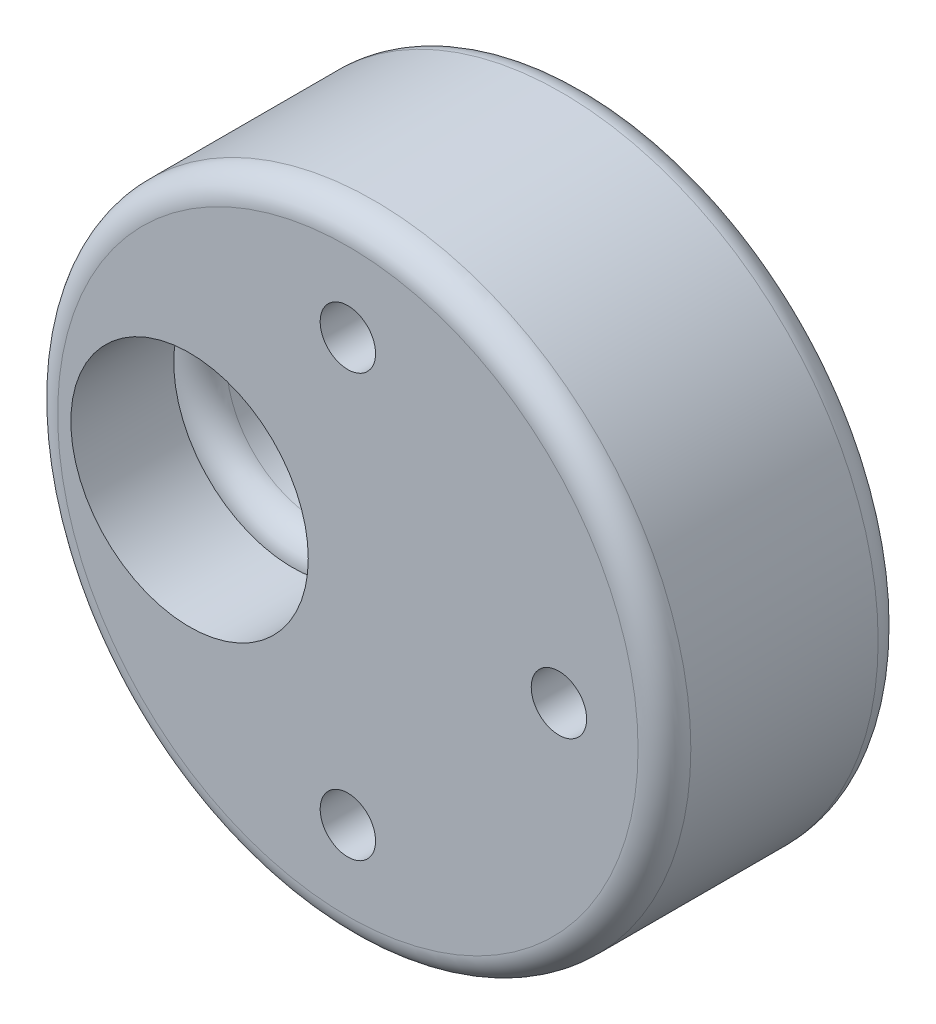
from build123d import *

# Parameters (mm, degrees)
SKETCH1_R           = 12
SKETCH1_R_2         = 1.05
BOSS_EXTRUDE1_DEPTH = 9.1
HOLE2_D             = 7
HOLE2_DEPTH         = 12
HOLE2_CBORE_D       = 9
HOLE2_CBORE_DEPTH   = 3.9
SKETCH8_R           = 2.15
CUT_EXTRUDE1_DEPTH  = 6.2
FILLET1_R           = 1


with BuildPart() as part:
    # Sketch1 → Boss-Extrude1 (new body)
    with BuildSketch(Plane.XY):
        Circle(SKETCH1_R)
        with Locations((0, 8)):
            Circle(SKETCH1_R_2, mode=Mode.SUBTRACT)
        with Locations((8, 0)):
            Circle(SKETCH1_R_2, mode=Mode.SUBTRACT)
        with Locations((0, -8)):
            Circle(SKETCH1_R_2, mode=Mode.SUBTRACT)
    extrude(amount=BOSS_EXTRUDE1_DEPTH)

    # Hole2
    with Locations(Plane.XY.offset(9.1)):
        with Locations((-6, 0)):
            CounterBoreHole(HOLE2_D / 2, HOLE2_CBORE_D / 2, HOLE2_CBORE_DEPTH, depth=HOLE2_DEPTH)

    # Sketch8 → Cut-Extrude1 (cut)
    with BuildSketch(Plane(origin=(0, 0, 0), x_dir=(-1, 0, 0), z_dir=(0, 0, -1))):
        with Locations((0, 8)):
            Circle(SKETCH8_R)
        with Locations((0, -8)):
            Circle(SKETCH8_R)
        with Locations((-8, 0)):
            Circle(SKETCH8_R)
    extrude(amount=-CUT_EXTRUDE1_DEPTH, mode=Mode.SUBTRACT)

    # Fillet1
    fillet1_edges = [part.edges().sort_by_distance(p)[0] for p in [
        (-12, 0, 0),
        (-2.5, 0, 0),
        (-2.5, 0, 5.2),
        (-12, 0, 9.1),
    ]]
    fillet(fillet1_edges, radius=FILLET1_R - 0.0001)  # a hair under: the kernel refuses the full size


solid = part.part
